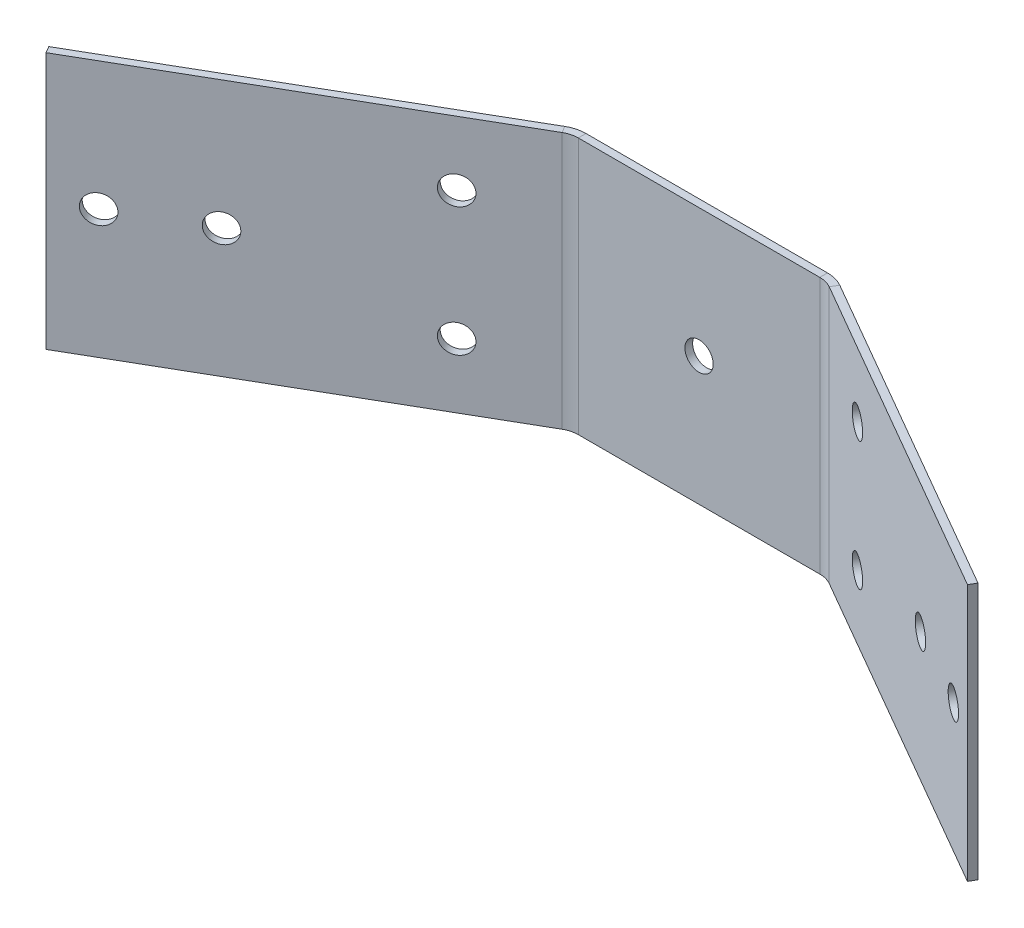
from build123d import *

# Parameters (mm, degrees)
SZKIC1_W                        = 400
SZKIC1_H                        = 100
DODANIE_WYCI_GNI_CIE1_DEPTH     = 3
SZKIC_ZGI_CIA1_DEPTH            = 100
SZKIC_ZGI_CIA1_2_DEPTH          = 100
WYTNIJ_WYCI_GNI_CIE4_DEPTH      = 401.746800829
WYTNIJ_WYCI_GNI_CIE4_DEPTH_BACK = 401.746800829
SZKIC18_R                       = 5.5
WYTNIJ_WYCI_GNI_CIE5_DEPTH      = 383.009072614
WYTNIJ_WYCI_GNI_CIE5_DEPTH_BACK = 383.009072614
SZKIC19_R                       = 5.5
WYTNIJ_WYCI_GNI_CIE6_DEPTH      = 363.537857428
WYTNIJ_WYCI_GNI_CIE6_DEPTH_BACK = 363.537857428
SZKIC20_R                       = 5.5
SZKIC21_R                       = 5.5
WYTNIJ_WYCI_GNI_CIE7_DEPTH      = 10


# Read off the part's stored shape, not the designer's step: Szkic zgięcia1
with BuildPart() as part:
    # Szkic1 → Dodanie-wyciągnięcie1 (new body)
    with BuildSketch(Plane.XY):
        with Locations((200, 50)):
            Rectangle(SZKIC1_W, SZKIC1_H)
    extrude(amount=DODANIE_WYCI_GNI_CIE1_DEPTH)

    # Szkic zgięcia1 outline → Szkic zgięcia1 (cut)
    with BuildSketch(Plane(origin=(0, 0, 0), x_dir=(1, 0, 0), z_dir=(0, 1, 0))):
        with BuildLine():
            Line((0, -3), (144.331201036, -3))
            Line((144.331201036, -3), (146.51069296, -1.741669751))
            ThreePointArc((146.51069296, -1.741669751), (149.646045374, -0.442964258), (153.01069296, 0))
            Line((153.01069296, 0), (0, 0))
            Line((0, 0), (0, -3))
        make_face()
        with BuildLine():
            Line((253.48930704, -1.741669751), (255.668798964, -3))
            Line((255.668798964, -3), (400, -3))
            Line((400, -3), (400, 0))
            Line((400, 0), (246.98930704, 0))
            ThreePointArc((246.98930704, 0), (250.353954626, -0.442964258), (253.48930704, -1.741669751))
        make_face()
    extrude(amount=SZKIC_ZGI_CIA1_DEPTH, mode=Mode.SUBTRACT)

    # Szkic zgi_cia1 2 outline → Szkic zgi_cia1 2 (add)
    with BuildSketch(Plane(origin=(0, 0, 0), x_dir=(1, 0, 0), z_dir=(0, 1, 0))):
        with BuildLine():
            Line((20.714218978, -77.834399482), (148.01069296, -4.339745962))
            ThreePointArc((148.01069296, -4.339745962), (150.422502509, -3.340741737), (153.01069296, -3))
            Line((153.01069296, -3), (144.331201036, -3))
            Line((144.331201036, -3), (19.214218978, -75.236323271))
            Line((19.214218978, -75.236323271), (20.714218978, -77.834399482))
        make_face()
        with BuildLine():
            Line((255.668798964, -3), (246.98930704, -3))
            ThreePointArc((246.98930704, -3), (249.577497491, -3.340741737), (251.98930704, -4.339745962))
            Line((251.98930704, -4.339745962), (379.285781022, -77.834399482))
            Line((379.285781022, -77.834399482), (380.785781022, -75.236323271))
            Line((380.785781022, -75.236323271), (255.668798964, -3))
        make_face()
    extrude(amount=SZKIC_ZGI_CIA1_2_DEPTH)

    # Szkic18 → Wytnij-wyciągnięcie4 (cut, two sides: drawn at the far end of the back side and taken through both)
    with BuildSketch(Plane.XY.offset(3).offset(-WYTNIJ_WYCI_GNI_CIE4_DEPTH_BACK)):
        with Locations(Location((200.00069296, 49.999999995, 0), (0, 0, 180))):
            Circle(SZKIC18_R)
    extrude(amount=WYTNIJ_WYCI_GNI_CIE4_DEPTH + WYTNIJ_WYCI_GNI_CIE4_DEPTH_BACK, mode=Mode.SUBTRACT)

    # Szkic19 → Wytnij-wyciągnięcie5 (cut, two sides: drawn at the far end of the back side and taken through both)
    with BuildSketch(Plane(origin=(61.118161635, 0, -105.859761218), x_dir=(0.8660254037844382, 0, 0.500000000000001), z_dir=(-0.500000000000001, 0, 0.8660254037844382)).offset(-WYTNIJ_WYCI_GNI_CIE5_DEPTH_BACK)):
        with Locations(Location((250.39901436, 75, 0), (0, 0, 180))):
            Circle(SZKIC19_R)
        with Locations(Location((250.39901436, 25, 0), (0, 0, 180))):
            Circle(SZKIC19_R)
        with Locations(Location((317.3883214, 50, 0), (0, 0, 180))):
            Circle(SZKIC19_R)
        with Locations(Location((352.3883214, 50, 0), (0, 0, 180))):
            Circle(SZKIC19_R)
    extrude(amount=WYTNIJ_WYCI_GNI_CIE5_DEPTH + WYTNIJ_WYCI_GNI_CIE5_DEPTH_BACK, mode=Mode.SUBTRACT)

    # Szkic20 → Wytnij-wyciągnięcie6 (cut, two sides: drawn at the far end of the back side and taken through both)
    with BuildSketch(Plane(origin=(38.881838365, 0, 67.345319539), x_dir=(0.8660254037844382, 0, -0.500000000000001), z_dir=(0.500000000000001, 0, 0.8660254037844382)).offset(-WYTNIJ_WYCI_GNI_CIE6_DEPTH_BACK)):
        with Locations((96.011147154, 75)):
            Circle(SZKIC20_R)
        with Locations((96.011147154, 25)):
            Circle(SZKIC20_R)
        with Locations((29.021840113, 50)):
            Circle(SZKIC20_R)
    extrude(amount=WYTNIJ_WYCI_GNI_CIE6_DEPTH + WYTNIJ_WYCI_GNI_CIE6_DEPTH_BACK, mode=Mode.SUBTRACT)

    # Szkic21 → Wytnij-wyciągnięcie7 (cut)
    with BuildSketch(Plane(origin=(38.881838365, 0, 67.345319539), x_dir=(0.8660254037844382, 0, -0.500000000000001), z_dir=(0.500000000000001, 0, 0.8660254037844382))):
        with Locations((-5.978159887, 50)):
            Circle(SZKIC21_R)
    extrude(amount=-WYTNIJ_WYCI_GNI_CIE7_DEPTH, mode=Mode.SUBTRACT)


solid = part.part
